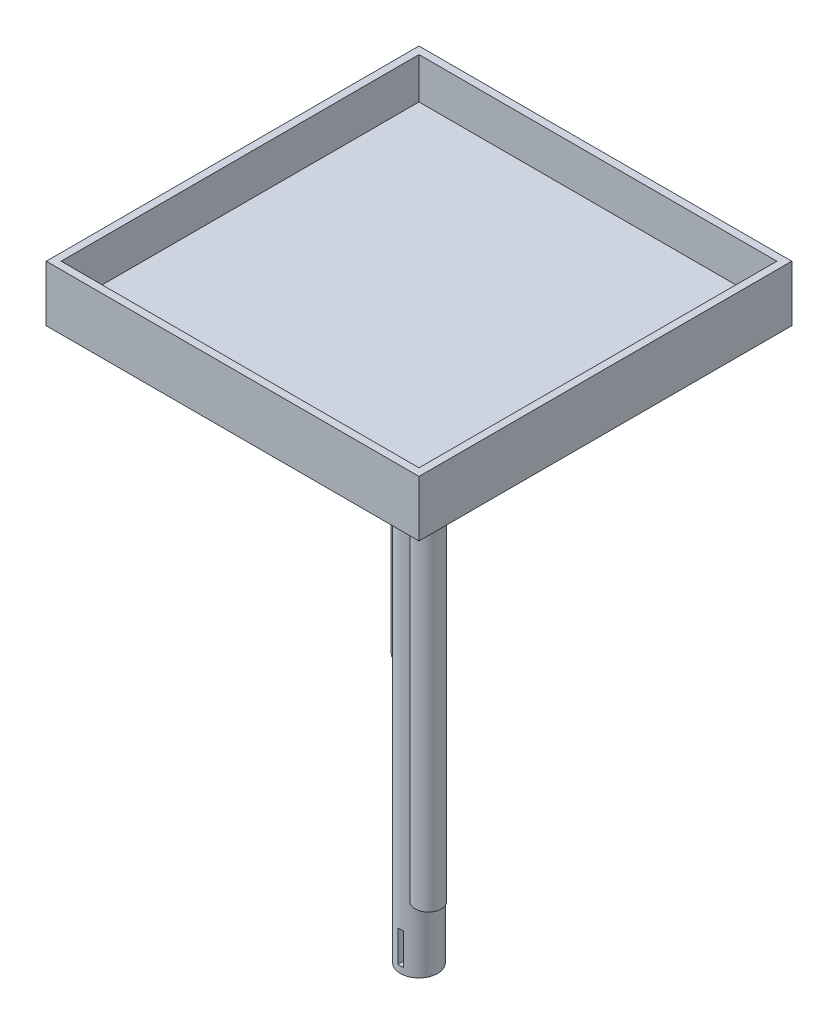
from build123d import *

# Parameters (mm, degrees)
ESBO_O1_W                = 100
ESBO_O1_H                = 100
RESSALTO_EXTRUS_O1_DEPTH = 15
ESBO_O2_W                = 96
ESBO_O2_H                = 96
CORTE_EXTRUS_O1_DEPTH    = 11
ESBO_O3_R                = 5
RESSALTO_EXTRUS_O2_DEPTH = 148
ESBO_O5_W                = 1.45
ESBO_O5_H                = 8.5
CORTE_EXTRUS_O2_DEPTH    = 186.483152874
ESBO_O7_R                = 3.5
RESSALTO_EXTRUS_O3_DEPTH = 105
FILETE2_R                = 5
FILETE3_R                = 5
FILETE4_R                = 5


with BuildPart() as part:
    # Esboço1 → Ressalto-extrusão1 (new body)
    with BuildSketch(Plane(origin=(0, 0, 0), x_dir=(1, 0, 0), z_dir=(0, 1, 0))):
        Rectangle(ESBO_O1_W, ESBO_O1_H)
    extrude(amount=RESSALTO_EXTRUS_O1_DEPTH)

    # Esboço2 → Corte-extrusão1 (cut)
    with BuildSketch(Plane(origin=(0, 15, 0), x_dir=(1, 0, 0), z_dir=(0, 1, 0))):
        Rectangle(ESBO_O2_W, ESBO_O2_H)
    extrude(amount=-CORTE_EXTRUS_O1_DEPTH, mode=Mode.SUBTRACT)

    # Esboço3 → Ressalto-extrusão2 (add)
    with BuildSketch(Plane(origin=(0, 0, 0), x_dir=(-1, 0, 0), z_dir=(0, -1, 0))):
        Circle(ESBO_O3_R)
    extrude(amount=RESSALTO_EXTRUS_O2_DEPTH)

    # Esboço5 → Corte-extrusão2 (cut, through all)
    with BuildSketch(Plane(origin=(0, 0, -50), x_dir=(-1, 0, 0), z_dir=(0, 0, -1))):
        with Locations((0, -142)):
            Rectangle(ESBO_O5_W, ESBO_O5_H)
    extrude(amount=-CORTE_EXTRUS_O2_DEPTH, mode=Mode.SUBTRACT)

    # Esboço7 → Ressalto-extrusão3 (add)
    with BuildSketch(Plane.XZ):
        with Locations((30, 27.5)):
            Circle(ESBO_O7_R)
        with Locations((-30, -27.5)):
            Circle(ESBO_O7_R)
    extrude(amount=RESSALTO_EXTRUS_O3_DEPTH)

    # Filete2
    filete2_edges = [part.edges().sort_by_distance(p)[0] for p in [
        (-33.5, 0, -27.5),
    ]]
    fillet(filete2_edges, radius=FILETE2_R)

    # Filete3
    filete3_edges = [part.edges().sort_by_distance(p)[0] for p in [
        (26.5, 0, 27.5),
    ]]
    fillet(filete3_edges, radius=FILETE3_R)

    # Filete4
    filete4_edges = [part.edges().sort_by_distance(p)[0] for p in [
        (5, 0, 0),
    ]]
    fillet(filete4_edges, radius=FILETE4_R)


solid = part.part
